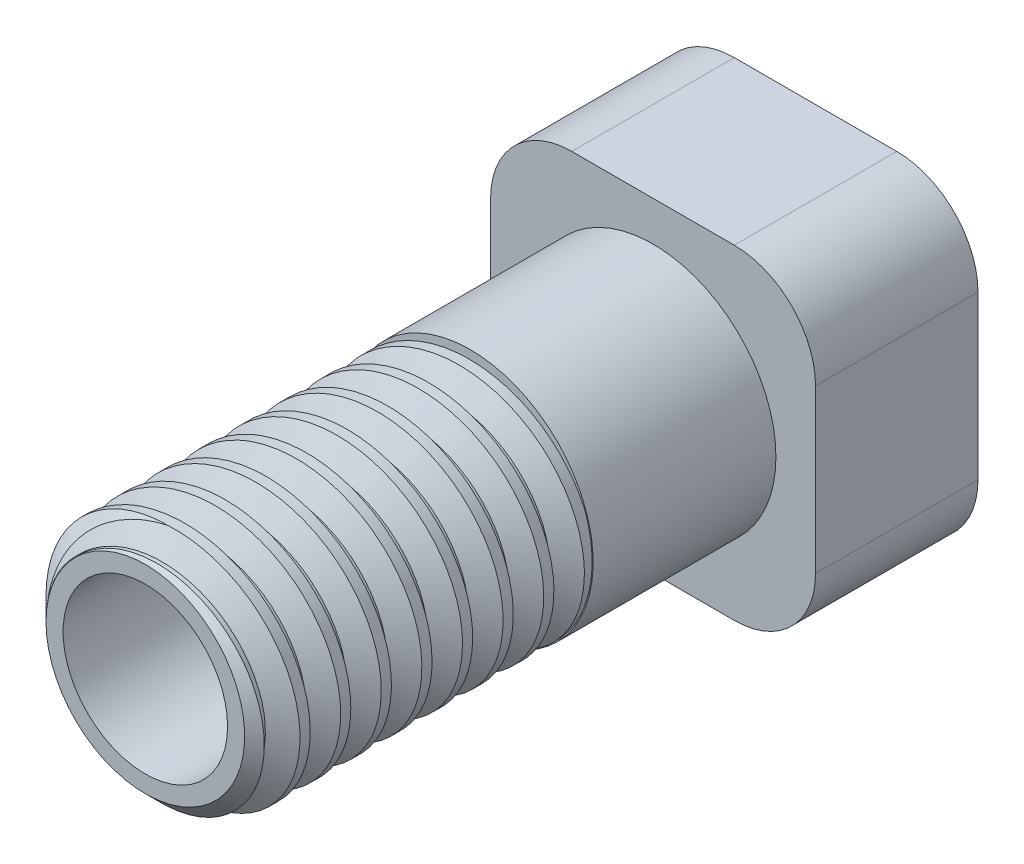
from build123d import *

# Parameters (mm, degrees)
ESBO_O1_R                    = 2.025
RESSALTO_EXTRUS_O1_DEPTH     = 16.5
CASCA1_T                     = 1
RESSALTO_EXTRUS_O2_START     = -4
RESSALTO_EXTRUS_O2_OUTLINE_W = 8
RESSALTO_EXTRUS_O2_OUTLINE_H = 8
RESSALTO_EXTRUS_O2_OUTLINE_R = 3.025
RESSALTO_EXTRUS_O2_DEPTH     = 4
FILETE1_R                    = 2
ROSCA2_PITCH                 = 1
ROSCA2_TO                    = 8.4455


with BuildPart() as part:
    # Esboço1 → Ressalto-extrusão1 (new body)
    with BuildSketch(Plane.XY):
        Circle(ESBO_O1_R)
    extrude(amount=RESSALTO_EXTRUS_O1_DEPTH)

    # Casca1
    casca1_openings = [part.faces().sort_by_distance(p)[0] for p in [
        (0, 0, 0),
        (0, 0, 16.5),
    ]]
    offset(amount=CASCA1_T, openings=casca1_openings, kind=Kind.INTERSECTION)

    # Ressalto-extrusão2: read off the stored shape, not the designer's step
    # Ressalto-extrusão2 outline → Ressalto-extrusão2 (add)
    with BuildSketch(Plane(origin=(0, 0, 0), x_dir=(-1, 0, 0), z_dir=(0, 0, -1)).offset(RESSALTO_EXTRUS_O2_START)):
        Rectangle(RESSALTO_EXTRUS_O2_OUTLINE_W, RESSALTO_EXTRUS_O2_OUTLINE_H)
        Circle(RESSALTO_EXTRUS_O2_OUTLINE_R, mode=Mode.SUBTRACT)
    extrude(amount=RESSALTO_EXTRUS_O2_DEPTH)

    # Filete1
    filete1_edges = [part.edges().sort_by_distance(p)[0] for p in [
        (-4, 4, 2),
        (-4, -4, 2),
        (4, -4, 2),
        (4, 4, 2),
    ]]
    fillet(filete1_edges, radius=FILETE1_R)

    # M6x1.0 Roscas usinadas Pino1: read off the stored shape, not the designer's step
    # M6x1.0 Roscas usinadas Pino1 outline → M6x1.0 Roscas usinadas Pino1 (revolve, cut)
    with BuildSketch(Plane.XZ):
        Polygon((3.025, 16.5), (2.4455, 16.5), (3, 15.9455), (3, 8.5), (3.025, 8.5), align=None)
    revolve(axis=Axis((0, 0, 0), (0, 0, 1)), mode=Mode.SUBTRACT)

    # Rosca2: arcs per turn and ends read off the stored shape
    # Rosca2: the profile of Perfil da rosca3 profile screwed along a right-hand helix through 12 turns, 8 arcs to a turn; built about Z, then put on its axis
    rosca2_z = Axis((0, 0, 0), (0, 0, 1))
    rosca2_corners = [(3.0003, 0, -0.000173205), (2.458734125, 0, 0.312499999), (2.458734125, 0, 0.437499999), (3.0003, 0, 0.750173202)]
    with BuildLine(mode=Mode.PRIVATE) as rosca2_profile:
        Line(rosca2_corners[0], rosca2_corners[1])
        Line(rosca2_corners[1], rosca2_corners[2])
        Line(rosca2_corners[2], rosca2_corners[3])
        Line(rosca2_corners[3], rosca2_corners[0])
    rosca2_cap = Face(rosca2_profile.wire())
    rosca2_turn_angles = [0, 22.5, 45, 67.5, 90, 112.5, 135, 157.5, 180, 202.5, 225, 247.5, 270, 292.5, 315, 337.5, 360]
    rosca2_turn_weights = [1, 0.9238795325112867, 1, 0.9238795325112867, 1, 0.9238795325112867, 1, 0.9238795325112867, 1, 0.9238795325112867, 1, 0.9238795325112867, 1, 0.9238795325112867, 1, 0.9238795325112867, 1]
    rosca2_turn_rails = [Edge.make_bspline([Vector(p[0], p[1], 0).rotate(rosca2_z, rosca2_turn_angles[k]) / rosca2_turn_weights[k] + Vector(0, 0, p[2] + ROSCA2_PITCH * rosca2_turn_angles[k] / 360) for k in range(17)], [0, 0, 0, 1, 1, 2, 2, 3, 3, 4, 4, 5, 5, 6, 6, 7, 7, 8, 8, 8], 2, rosca2_turn_weights) for p in rosca2_corners]
    rosca2_turn_sides = [Face.make_surface_from_curves(rosca2_turn_rails[p[0]], rosca2_turn_rails[p[1]]) for p in [(0, 1), (1, 2), (2, 3), (3, 0)]]
    rosca2 = Plane(origin=(0, 0, 16.9455), x_dir=(-1, 0, 0), z_dir=(0, 0, -1)) * split(Solid(Shell([*[p.moved(Location((0, 0, ROSCA2_PITCH * i))) for i in range(12) for p in rosca2_turn_sides], rosca2_cap, rosca2_cap.rotate(rosca2_z, 4320).moved(Location((0, 0, ROSCA2_PITCH * 4320 / 360)))])), bisect_by=Plane.XY.offset(ROSCA2_TO), keep=Keep.BOTTOM, mode=Mode.PRIVATE)
    add(rosca2, mode=Mode.SUBTRACT)


solid = part.part
